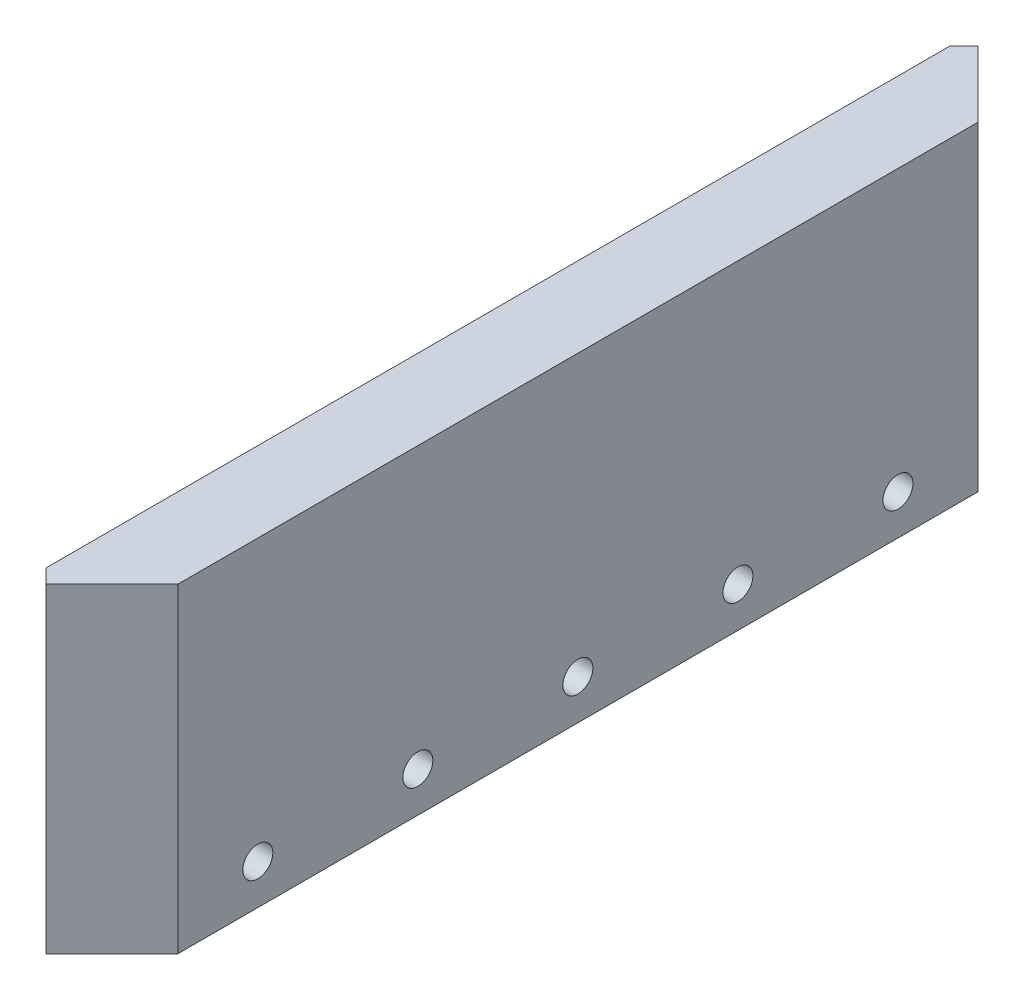
from build123d import *

# Parameters (mm, degrees)
SKETCH1_W           = 152.4
SKETCH1_H           = 50.8
BOSS_EXTRUDE1_DEPTH = 12.7
CUT_EXTRUDE1_DEPTH  = 93.457395594
CUT_EXTRUDE2_DEPTH  = 93.457395594
SKETCH4_R           = 2.38125
CUT_EXTRUDE3_DEPTH  = 80.219836874
LPATTERN1_COUNT     = 5
LPATTERN1_PITCH     = 25.4


with BuildPart() as part:
    # Sketch1 → Boss-Extrude1 (new body)
    with BuildSketch(Plane(origin=(0, 0, 0), x_dir=(0, 0, -1), z_dir=(1, 0, 0))):
        Rectangle(SKETCH1_W, SKETCH1_H)
    extrude(amount=BOSS_EXTRUDE1_DEPTH)

    # Sketch2 → Cut-Extrude1 (cut, through all)
    with BuildSketch(Plane(origin=(0, 25.4, 0), x_dir=(1, 0, 0), z_dir=(0, 1, 0))):
        Polygon((0, 76.2), (12.7, 63.5), (12.7, 76.2), align=None)
        Polygon((0, -76.2), (12.7, -63.5), (12.7, -76.2), align=None)
    extrude(amount=-CUT_EXTRUDE1_DEPTH, mode=Mode.SUBTRACT)

    # Sketch3 → Cut-Extrude2 (cut, through all)
    with BuildSketch(Plane(origin=(0, 25.4, 0), x_dir=(1, 0, 0), z_dir=(0, 1, 0))):
        Polygon((0, 71.709871939), (2.24506403, 73.95493597), (0, 76.2), align=None)
        Polygon((0, -76.2), (0, -71.709871939), (2.24506403, -73.95493597), align=None)
    extrude(amount=-CUT_EXTRUDE2_DEPTH, mode=Mode.SUBTRACT)

    # Sketch4 → Cut-Extrude3 (cut, through all)
    with BuildSketch(Plane.ZY):
        with Locations((-50.8, -19.05)):
            Circle(SKETCH4_R)
    cut_extrude3 = extrude(amount=-CUT_EXTRUDE3_DEPTH, mode=Mode.SUBTRACT)

    # LPattern1: Cut-Extrude3 ×5
    with Locations(*[(0, 0, i * LPATTERN1_PITCH) for i in range(1, LPATTERN1_COUNT)]):
        add(cut_extrude3, mode=Mode.SUBTRACT)


solid = part.part
